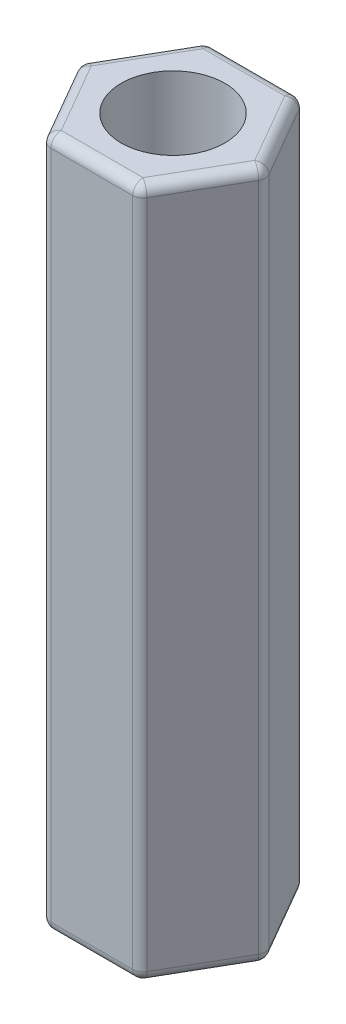
from build123d import *

# Parameters (mm, degrees)
SKETCH_1_R      = 1.5
EXTRUDE_1_DEPTH = 20
FILLET_1_R      = 0.3


with BuildPart() as part:
    # 草图1 → 凸台-拉伸1 (new body)
    with BuildSketch(Plane(origin=(0, 0, 0), x_dir=(1, 0, 0), z_dir=(0, 1, 0))):
        Polygon((2.713546265, 0), (1.356773133, 2.35), (-1.356773133, 2.35), (-2.713546265, 0), (-1.356773133, -2.35), (1.356773133, -2.35), align=None)
        Circle(SKETCH_1_R, mode=Mode.SUBTRACT)
    extrude(amount=EXTRUDE_1_DEPTH)

    # 圆角1
    fillet_1_edges = [part.edges().sort_by_distance(p)[0] for p in [
        (2.713546265, 10, 0),
        (1.356773133, 10, -2.35),
        (-1.356773133, 10, -2.35),
        (-2.713546265, 10, 0),
        (-1.356773133, 10, 2.35),
        (1.356773133, 10, 2.35),
        (0, 20, 2.35),
        (-2.035159699, 20, 1.175),
        (-2.035159699, 20, -1.175),
        (0, 20, -2.35),
        (2.035159699, 20, -1.175),
        (2.035159699, 20, 1.175),
        (0, 0, 2.35),
        (-2.035159699, 0, 1.175),
        (-2.035159699, 0, -1.175),
        (0, 0, -2.35),
        (2.035159699, 0, -1.175),
        (2.035159699, 0, 1.175),
    ]]
    fillet(fillet_1_edges, radius=FILLET_1_R)


solid = part.part
